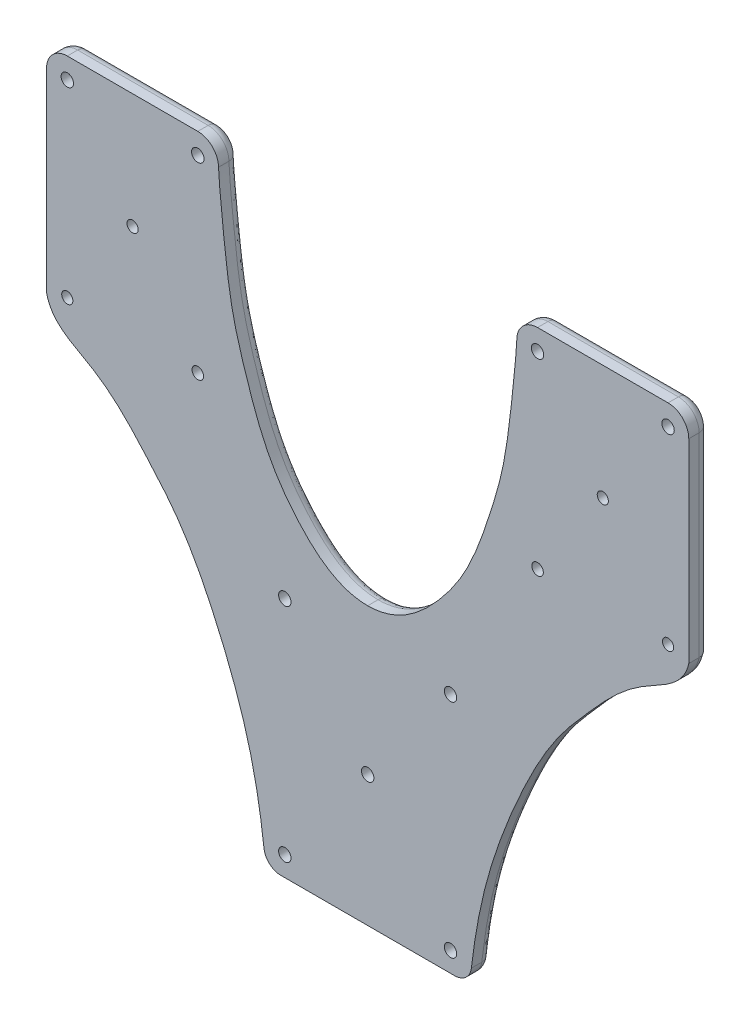
from build123d import *

# Parameters (mm, degrees)
BOSS_EXTRUDE1_OUTLINE_R   = 1.5
BOSS_EXTRUDE1_OUTLINE_R_2 = 1.351565459
BOSS_EXTRUDE1_OUTLINE_R_3 = 1.393771657
BOSS_EXTRUDE1_OUTLINE_R_4 = 1.34499477
BOSS_EXTRUDE1_DEPTH       = 5
FILLET1_R                 = 2.5


# Read off the part's stored shape, not the designer's step: Boss-Extrude1
with BuildPart() as part:
    # Boss-Extrude1 outline → Boss-Extrude1 (new body)
    with BuildSketch(Plane.XY):
        with BuildLine():
            Line((20.543517798, -76.835095143), (62.508654215, -76.835095143))
            ThreePointArc((62.508654215, -76.835095143), (65.213005357, -75.806708759), (66.550718451, -73.24124246))
            add(Edge.make_bspline(
                [(119.026086007, 16.688519672), (117.745357791, 10.844408757), (105.288982879, 6.685916739), (96.262363686, -4.040206459), (85.664900031, -16.080870336), (77.162109763, -32.511592261), (69.53486105, -53.321664529), (67.23955426, -67.393813527), (66.550718451, -73.24124246)],
                knots=[0, 0, 0, 0, 0.148716898, 0.335765639, 0.381291722, 0.603977721, 0.836429776, 1, 1, 1, 1], degree=3))
            Line((119.026086007, 16.688519672), (119.026086007, 63.664904857))
            ThreePointArc((119.026086007, 63.664904857), (117.561619913, 67.200438763), (114.026086007, 68.664904857))
            Line((114.026086007, 68.664904857), (82.526086007, 68.664904857))
            ThreePointArc((82.526086007, 68.664904857), (78.990552101, 67.200438763), (77.526086007, 63.664904857))
            add(Edge.make_bspline(
                [(77.526086007, 63.664904857), (77.526086007, 62.019008458), (75.962083537, 45.774860045), (74.018950645, 33.36354995), (70.072443892, 20.731323629), (65.736143213, 9.053019537), (57.063522016, -3.128804501), (48.358904027, -9.995236007), (34.693267986, -9.995236007), (25.988649998, -3.128804501), (17.3160288, 9.053019537), (12.979728121, 20.731323629), (9.033221368, 33.36354995), (7.090088476, 45.774860045), (5.526086007, 62.019008458), (5.526086007, 63.664904857)],
                knots=[0, 0, 0, 0, 0.202343183, 0.35635165, 0.491150837, 0.641450126, 0.782977724, 1, 1, 1.217022276, 1.358549874, 1.508849163, 1.64364835, 1.797656817, 2, 2, 2, 2], degree=3))
            ThreePointArc((5.526086007, 63.664904857), (4.061619913, 67.200438763), (0.526086007, 68.664904857))
            Line((0.526086007, 68.664904857), (-30.973913993, 68.664904857))
            ThreePointArc((-30.973913993, 68.664904857), (-34.509447899, 67.200438763), (-35.973913993, 63.664904857))
            Line((-35.973913993, 63.664904857), (-35.973913993, 16.688519672))
            add(Edge.make_bspline(
                [(-35.973913993, 16.688519672), (-34.693185778, 10.844408757), (-22.236810866, 6.685916739), (-13.210191672, -4.040206459), (-2.612728018, -16.080870336), (5.89006225, -32.511592261), (13.517310963, -53.321664529), (15.812617753, -67.393813527), (16.501453562, -73.24124246)],
                knots=[0, 0, 0, 0, 0.148716898, 0.335765639, 0.381291722, 0.603977721, 0.836429776, 1, 1, 1, 1], degree=3))
            ThreePointArc((16.501453562, -73.24124246), (17.839166656, -75.806708759), (20.543517798, -76.835095143))
        make_face()
        with Locations((21.526086007, -72.020016414)):
            Circle(BOSS_EXTRUDE1_OUTLINE_R, mode=Mode.SUBTRACT)
        with Locations((21.526086007, -18.507715742)):
            Circle(BOSS_EXTRUDE1_OUTLINE_R, mode=Mode.SUBTRACT)
        with Locations((61.526086007, -72.020016414)):
            Circle(BOSS_EXTRUDE1_OUTLINE_R, mode=Mode.SUBTRACT)
        with Locations((41.526086007, -45.263866078)):
            Circle(BOSS_EXTRUDE1_OUTLINE_R, mode=Mode.SUBTRACT)
        with Locations((61.526086007, -18.507715742)):
            Circle(BOSS_EXTRUDE1_OUTLINE_R, mode=Mode.SUBTRACT)
        with Locations((-30.973913993, 18.164904857)):
            Circle(BOSS_EXTRUDE1_OUTLINE_R_2, mode=Mode.SUBTRACT)
        with Locations((0.526086007, 18.164904857)):
            Circle(BOSS_EXTRUDE1_OUTLINE_R_3, mode=Mode.SUBTRACT)
        with Locations((-15.223913993, 40.914904857)):
            Circle(BOSS_EXTRUDE1_OUTLINE_R_4, mode=Mode.SUBTRACT)
        with Locations((-30.973913993, 63.664904857)):
            Circle(BOSS_EXTRUDE1_OUTLINE_R, mode=Mode.SUBTRACT)
        with Locations((0.526086007, 63.664904857)):
            Circle(BOSS_EXTRUDE1_OUTLINE_R, mode=Mode.SUBTRACT)
        with Locations((82.526086007, 18.164904857)):
            Circle(BOSS_EXTRUDE1_OUTLINE_R_3, mode=Mode.SUBTRACT)
        with Locations((114.026086007, 18.164904857)):
            Circle(BOSS_EXTRUDE1_OUTLINE_R_2, mode=Mode.SUBTRACT)
        with Locations((98.276086007, 40.914904857)):
            Circle(BOSS_EXTRUDE1_OUTLINE_R_4, mode=Mode.SUBTRACT)
        with Locations((82.526086007, 63.664904857)):
            Circle(BOSS_EXTRUDE1_OUTLINE_R, mode=Mode.SUBTRACT)
        with Locations((114.026086007, 63.664904857)):
            Circle(BOSS_EXTRUDE1_OUTLINE_R, mode=Mode.SUBTRACT)
    extrude(amount=BOSS_EXTRUDE1_DEPTH)

    # Fillet1
    fillet1_edges = [part.edges().sort_by_distance(p)[0] for p in [
        (17.839166656, -75.806708759, 0),
        (0.245752698, -22.113731068, 0),
        (-35.973913993, 40.176712265, 0),
        (-34.509447899, 67.200438763, 0),
        (-15.223913993, 68.664904857, 0),
        (4.061619913, 67.200438763, 0),
        (41.526086007, -9.995236007, 0),
        (41.526086007, -9.995236007, 0),
        (78.990552101, 67.200438763, 0),
        (98.276086007, 68.664904857, 0),
        (117.561619913, 67.200438763, 0),
        (119.026086007, 40.176712264, 0),
        (82.806419316, -22.113731068, 0),
        (65.213005357, -75.806708759, 0),
        (41.526086006, -76.835095143, 0),
    ]]
    fillet(fillet1_edges, radius=FILLET1_R)


solid = part.part
